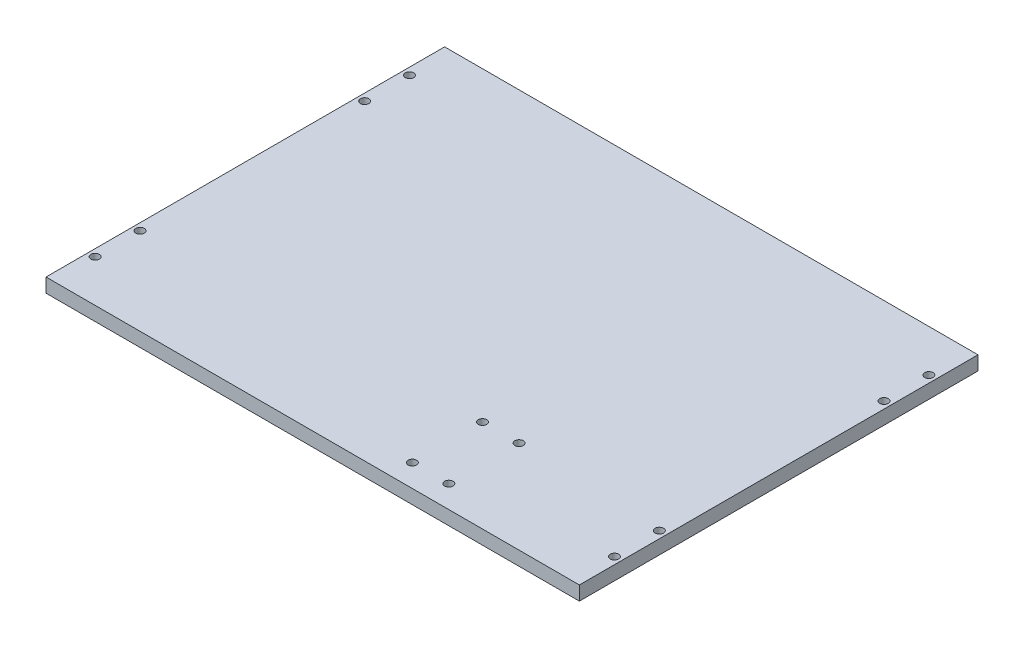
from build123d import *

# Parameters (mm, degrees)
SKETCH1_W           = 95
SKETCH1_H           = 142
SKETCH1_R           = 1.5
BOSS_EXTRUDE1_DEPTH = 5
CUT_EXTRUDE1_REACH  = 172.921
SKETCH2_R           = 1.5
CUT_EXTRUDE2_REACH  = 172.921
SKETCH3_R           = 1.5


with BuildPart() as part:
    # Sketch1 → Boss-Extrude1 (new body)
    with BuildSketch(Plane(origin=(0, 0, 0), x_dir=(1, 0, 0), z_dir=(0, 1, 0))):
        with Locations((47.5, 71)):
            Rectangle(SKETCH1_W, SKETCH1_H)
        with Locations((92.5, 15)):
            Circle(SKETCH1_R, mode=Mode.SUBTRACT)
        with Locations((92.5, 31)):
            Circle(SKETCH1_R, mode=Mode.SUBTRACT)
        with Locations((92.5, 127)):
            Circle(SKETCH1_R, mode=Mode.SUBTRACT)
        with Locations((92.5, 111)):
            Circle(SKETCH1_R, mode=Mode.SUBTRACT)
    boss_extrude1 = extrude(amount=BOSS_EXTRUDE1_DEPTH)

    # Mirror1: Boss-Extrude1 across plane
    add(boss_extrude1.mirror(Plane(origin=(0, 5, 0), x_dir=(0, 0, 1), z_dir=(1, 0, 0))))

    # Sketch2 → Cut-Extrude1 (cut, up to next)
    with BuildSketch(Plane(origin=(0, 5, 0), x_dir=(1, 0, 0), z_dir=(0, 1, 0)), mode=Mode.PRIVATE) as cut_extrude1_sk1:
        with Locations((27.5, 8)):
            Circle(SKETCH2_R)
    cut_extrude1_tool1 = extrude(cut_extrude1_sk1.sketch, amount=-CUT_EXTRUDE1_REACH, mode=Mode.PRIVATE) & part.part
    # Sketch2 → Cut-Extrude1 (cut, up to next)
    with BuildSketch(Plane(origin=(0, 5, 0), x_dir=(1, 0, 0), z_dir=(0, 1, 0)), mode=Mode.PRIVATE) as cut_extrude1_sk2:
        with Locations((27.5, 33)):
            Circle(SKETCH2_R)
    cut_extrude1_tool2 = extrude(cut_extrude1_sk2.sketch, amount=-CUT_EXTRUDE1_REACH, mode=Mode.PRIVATE) & part.part
    add(cut_extrude1_tool1.solids().sort_by_distance((27.5, 5, -8))[0], mode=Mode.SUBTRACT)
    add(cut_extrude1_tool2.solids().sort_by_distance((27.5, 5, -33))[0], mode=Mode.SUBTRACT)

    # Sketch3 → Cut-Extrude2 (cut, up to next)
    with BuildSketch(Plane(origin=(0, 5, 0), x_dir=(1, 0, 0), z_dir=(0, 1, 0)), mode=Mode.PRIVATE) as cut_extrude2_sk1:
        with Locations((40.5, 33)):
            Circle(SKETCH3_R)
    cut_extrude2_tool1 = extrude(cut_extrude2_sk1.sketch, amount=-CUT_EXTRUDE2_REACH, mode=Mode.PRIVATE) & part.part
    # Sketch3 → Cut-Extrude2 (cut, up to next)
    with BuildSketch(Plane(origin=(0, 5, 0), x_dir=(1, 0, 0), z_dir=(0, 1, 0)), mode=Mode.PRIVATE) as cut_extrude2_sk2:
        with Locations((40.5, 8)):
            Circle(SKETCH3_R)
    cut_extrude2_tool2 = extrude(cut_extrude2_sk2.sketch, amount=-CUT_EXTRUDE2_REACH, mode=Mode.PRIVATE) & part.part
    add(cut_extrude2_tool1.solids().sort_by_distance((40.5, 5, -33))[0], mode=Mode.SUBTRACT)
    add(cut_extrude2_tool2.solids().sort_by_distance((40.5, 5, -8))[0], mode=Mode.SUBTRACT)


solid = part.part
